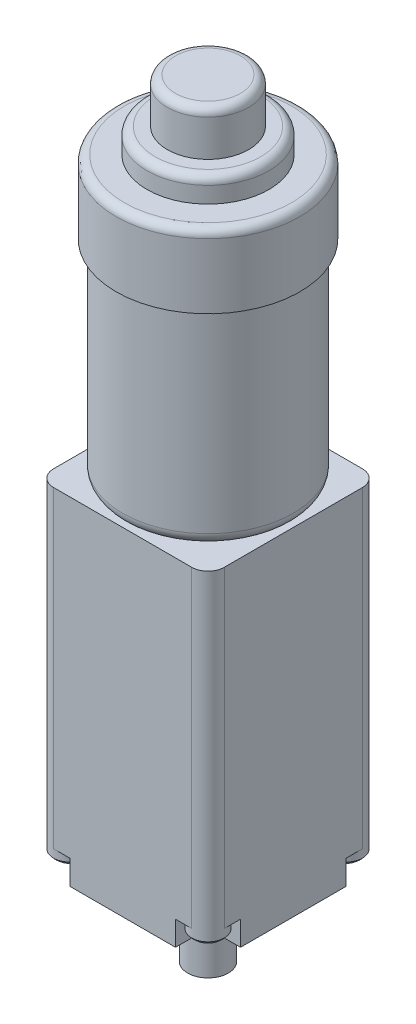
from build123d import *

# Parameters (mm, degrees)
SKETCH3_W           = 42
SKETCH3_H           = 42
BOSS_EXTRUDE1_DEPTH = 77
FILLET1_R           = 4
BOSS_EXTRUDE2_START = 6
SKETCH4_R           = 2
BOSS_EXTRUDE2_DEPTH = 6
SKETCH5_R           = 12.5
BOSS_EXTRUDE3_DEPTH = 2
SKETCH6_R           = 5
BOSS_EXTRUDE4_DEPTH = 18
CUT_EXTRUDE1_START  = -14
CUT_EXTRUDE1_DEPTH  = 14


with BuildPart() as part:
    # Sketch2 → Revolve1 (revolve)
    with BuildSketch(Plane.XY):
        with BuildLine():
            Line((51.91607647, 6.388694309), (33.91607647, 6.388694309))
            Line((33.91607647, 6.388694309), (33.91607647, 92.388694309))
            Line((33.91607647, 92.388694309), (41.91607647, 92.388694309))
            ThreePointArc((41.91607647, 92.388694309), (43.330290032, 91.802907871), (43.91607647, 90.388694309))
            Line((43.91607647, 90.388694309), (43.91607647, 81.388694309))
            Line((43.91607647, 81.388694309), (46.91607647, 81.388694309))
            ThreePointArc((46.91607647, 81.388694309), (48.330290032, 80.802907871), (48.91607647, 79.388694309))
            Line((48.91607647, 79.388694309), (48.91607647, 75.388694309))
            Line((48.91607647, 75.388694309), (54.51607647, 75.388694309))
            ThreePointArc((54.51607647, 75.388694309), (55.930290032, 74.802907871), (56.51607647, 73.388694309))
            Line((56.51607647, 73.388694309), (56.51607647, 57.388694309))
            Line((56.51607647, 57.388694309), (54.91607647, 57.388694309))
            Line((54.91607647, 57.388694309), (54.91607647, 9.388694309))
            ThreePointArc((54.91607647, 9.388694309), (54.037396814, 7.267373966), (51.91607647, 6.388694309))
        make_face()
    revolve(axis=Axis((33.91607647, 106.807233563, 0), (0, -1, 0)))

    # Sketch3 → Boss-Extrude1 (add)
    with BuildSketch(Plane.XZ.offset(-6.388694309)):
        with Locations((33.91607647, 0)):
            Rectangle(SKETCH3_W, SKETCH3_H)
    extrude(amount=BOSS_EXTRUDE1_DEPTH)

    # Fillet1
    fillet1_edges = [part.edges().sort_by_distance(p)[0] for p in [
        (12.91607647, -32.111305691, -21),
        (54.91607647, -32.111305691, -21),
        (12.91607647, -32.111305691, 21),
        (54.91607647, -32.111305691, 21),
    ]]
    fillet(fillet1_edges, radius=FILLET1_R)

    # Sketch4 → Boss-Extrude2 (add)
    with BuildSketch(Plane.XZ.offset(70.611305691).offset(BOSS_EXTRUDE2_START)):
        with BuildLine():
            Line((20.91607647, -21), (46.91607647, -21))
            Line((46.91607647, -21), (46.91607647, -17))
            ThreePointArc((46.91607647, -17), (48.087649345, -14.171572875), (50.91607647, -13))
            Line((50.91607647, -13), (54.91607647, -13))
            Line((54.91607647, -13), (54.91607647, 13))
            Line((54.91607647, 13), (50.91607647, 13))
            ThreePointArc((50.91607647, 13), (48.087649345, 14.171572875), (46.91607647, 17))
            Line((46.91607647, 17), (46.91607647, 21))
            Line((46.91607647, 21), (20.91607647, 21))
            Line((20.91607647, 21), (20.91607647, 17))
            ThreePointArc((20.91607647, 17), (19.744503595, 14.171572875), (16.91607647, 13))
            Line((16.91607647, 13), (12.91607647, 13))
            Line((12.91607647, 13), (12.91607647, -13))
            Line((12.91607647, -13), (16.91607647, -13))
            ThreePointArc((16.91607647, -13), (19.744503595, -14.171572875), (20.91607647, -17))
            Line((20.91607647, -17), (20.91607647, -21))
        make_face()
        with Locations((16.91607647, 0)):
            Circle(SKETCH4_R, mode=Mode.SUBTRACT)
        with Locations((50.91607647, 0)):
            Circle(SKETCH4_R, mode=Mode.SUBTRACT)
        with Locations((33.91607647, -17)):
            Circle(SKETCH4_R, mode=Mode.SUBTRACT)
        with Locations((33.91607647, 17)):
            Circle(SKETCH4_R, mode=Mode.SUBTRACT)
    extrude(amount=-BOSS_EXTRUDE2_DEPTH)

    # Sketch5 → Boss-Extrude3 (add)
    with BuildSketch(Plane.XZ.offset(76.611305691)):
        with Locations((33.91607647, 0)):
            Circle(SKETCH5_R)
    extrude(amount=BOSS_EXTRUDE3_DEPTH)

    # Sketch6 → Boss-Extrude4 (add)
    with BuildSketch(Plane.XZ.offset(78.611305691)):
        with Locations((33.91607647, 0)):
            Circle(SKETCH6_R)
    extrude(amount=BOSS_EXTRUDE4_DEPTH)

    # Sketch7 → Cut-Extrude1 (cut)
    with BuildSketch(Plane.XZ.offset(96.611305691).offset(CUT_EXTRUDE1_START)):
        with BuildLine():
            Line((30.71607647, 3.841874542), (30.71607647, -3.841874542))
            ThreePointArc((30.71607647, -3.841874542), (28.91607647, 0), (30.71607647, 3.841874542))
        make_face()
    extrude(amount=CUT_EXTRUDE1_DEPTH, mode=Mode.SUBTRACT)

    # Sketch10 → Revolve4 (revolve)
    with BuildSketch(Plane.XY.offset(17)):
        with BuildLine():
            Line((12.91607647, -70.611305691), (12.91607647, -72.611305691))
            ThreePointArc((12.91607647, -72.611305691), (14.680008493, -74.083441646), (16.91607647, -74.611305691))
            Line((16.91607647, -74.611305691), (16.91607647, -70.611305691))
            Line((16.91607647, -70.611305691), (12.91607647, -70.611305691))
        make_face()
    revolve4 = revolve(axis=Axis((16.91607647, -67.890030262, 17), (0, -1, 0)))

    # Mirror1: Revolve4 across plane
    add(revolve4.mirror(Plane(origin=(0, 0, 0), x_dir=(1, 0, 0), z_dir=(0, 0, -1))))

    # Mirror2 copy 1 sketch → Mirror2 copy 1 (revolve)
    with BuildSketch(Plane(origin=(67.83215294, 0, -17), x_dir=(-1, 0, 0), z_dir=(0, 0, -1))):
        with BuildLine():
            Line((12.91607647, -70.611305691), (12.91607647, -72.611305691))
            ThreePointArc((12.91607647, -72.611305691), (14.680008493, -74.083441646), (16.91607647, -74.611305691))
            Line((16.91607647, -74.611305691), (16.91607647, -70.611305691))
            Line((16.91607647, -70.611305691), (12.91607647, -70.611305691))
        make_face()
    revolve(axis=Axis((50.91607647, -67.890030262, -17), (0, -1, 0)))

    # Mirror2 copy 2 sketch → Mirror2 copy 2 (revolve)
    with BuildSketch(Plane(origin=(67.83215294, 0, 17), x_dir=(-1, 0, 0), z_dir=(0, 0, 1))):
        with BuildLine():
            Line((12.91607647, 70.611305691), (12.91607647, 72.611305691))
            ThreePointArc((12.91607647, 72.611305691), (14.680008493, 74.083441646), (16.91607647, 74.611305691))
            Line((16.91607647, 74.611305691), (16.91607647, 70.611305691))
            Line((16.91607647, 70.611305691), (12.91607647, 70.611305691))
        make_face()
    revolve(axis=Axis((50.91607647, -67.890030262, 17), (0, 1, 0)))


solid = part.part
